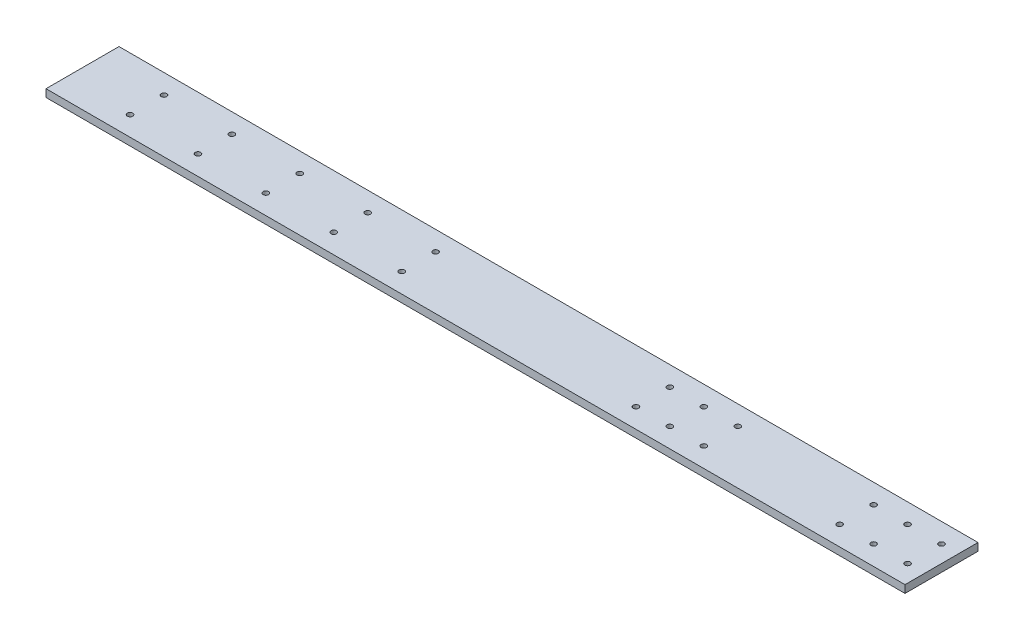
from build123d import *

# Parameters (mm, degrees)
SKETCH1_W           = 506
SKETCH1_H           = 43
SKETCH1_R           = 1.6
BOSS_EXTRUDE1_DEPTH = 4.5


with BuildPart() as part:
    # Sketch1 → Boss-Extrude1 (new body)
    with BuildSketch(Plane(origin=(0, 0, 0), x_dir=(1, 0, 0), z_dir=(0, 1, 0))):
        Rectangle(SKETCH1_W, SKETCH1_H)
        with Locations((-215, 10)):
            Circle(SKETCH1_R, mode=Mode.SUBTRACT)
        with Locations((-175, 10)):
            Circle(SKETCH1_R, mode=Mode.SUBTRACT)
        with Locations((-135, 10)):
            Circle(SKETCH1_R, mode=Mode.SUBTRACT)
        with Locations((-95, 10)):
            Circle(SKETCH1_R, mode=Mode.SUBTRACT)
        with Locations((-55, 10)):
            Circle(SKETCH1_R, mode=Mode.SUBTRACT)
        with Locations((-175, -10)):
            Circle(SKETCH1_R, mode=Mode.SUBTRACT)
        with Locations((-135, -10)):
            Circle(SKETCH1_R, mode=Mode.SUBTRACT)
        with Locations((-95, -10)):
            Circle(SKETCH1_R, mode=Mode.SUBTRACT)
        with Locations((-55, -10)):
            Circle(SKETCH1_R, mode=Mode.SUBTRACT)
        with Locations((-215, -10)):
            Circle(SKETCH1_R, mode=Mode.SUBTRACT)
        with Locations((223, 10)):
            Circle(SKETCH1_R, mode=Mode.SUBTRACT)
        with Locations((103, 10)):
            Circle(SKETCH1_R, mode=Mode.SUBTRACT)
        with Locations((103, -10)):
            Circle(SKETCH1_R, mode=Mode.SUBTRACT)
        with Locations((223, -10)):
            Circle(SKETCH1_R, mode=Mode.SUBTRACT)
        with Locations((123, -10)):
            Circle(SKETCH1_R, mode=Mode.SUBTRACT)
        with Locations((123, 10)):
            Circle(SKETCH1_R, mode=Mode.SUBTRACT)
        with Locations((243, 10)):
            Circle(SKETCH1_R, mode=Mode.SUBTRACT)
        with Locations((243, -10)):
            Circle(SKETCH1_R, mode=Mode.SUBTRACT)
        with Locations((83, -10)):
            Circle(SKETCH1_R, mode=Mode.SUBTRACT)
        with Locations((83, 10)):
            Circle(SKETCH1_R, mode=Mode.SUBTRACT)
        with Locations((203, 10)):
            Circle(SKETCH1_R, mode=Mode.SUBTRACT)
        with Locations((203, -10)):
            Circle(SKETCH1_R, mode=Mode.SUBTRACT)
    extrude(amount=BOSS_EXTRUDE1_DEPTH)


solid = part.part
